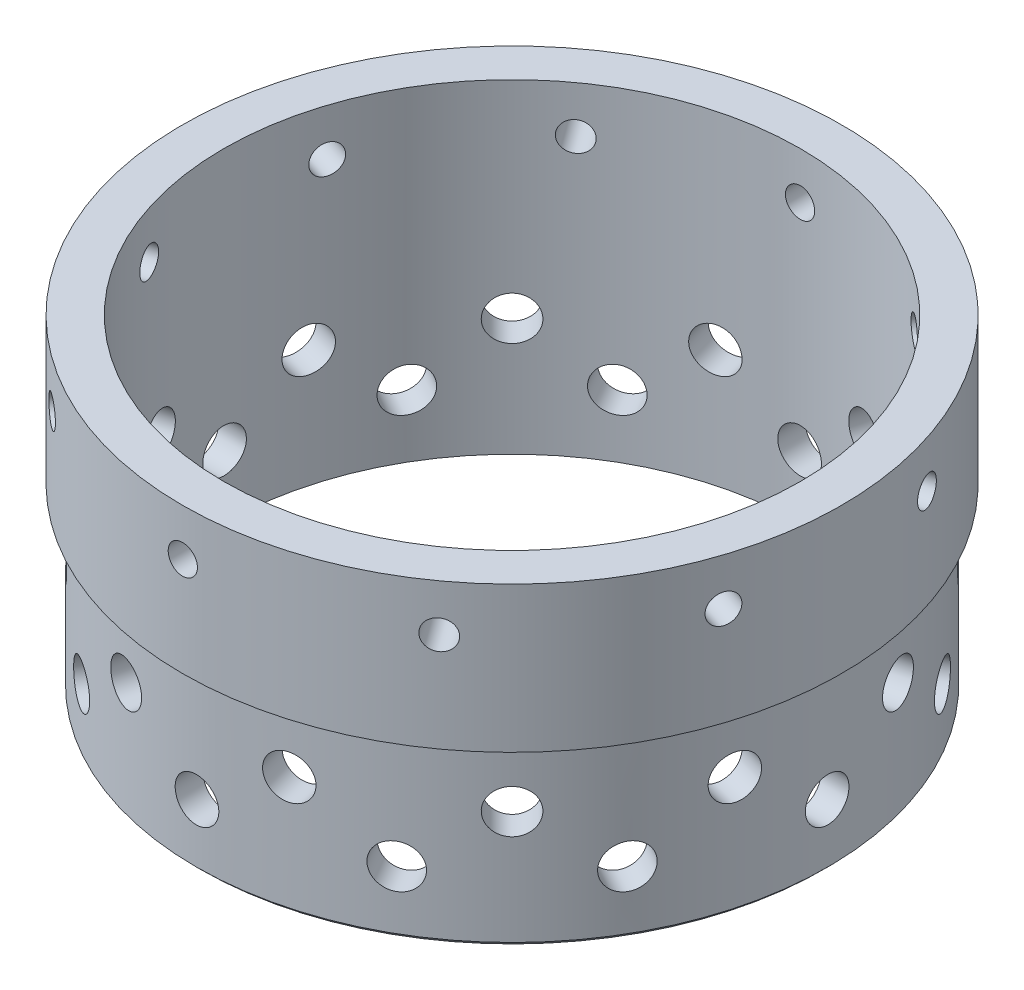
from build123d import *

# Parameters (mm, degrees)
SKETCH1_R           = 76.1238
SKETCH1_R_2         = 66.5988
BOSS_EXTRUDE1_DEPTH = 12.7
BOSS_EXTRUDE2_START = -41.275
SKETCH1_3_R         = 72.9488
SKETCH1_3_R_2       = 66.5988
BOSS_EXTRUDE2_DEPTH = 41.275
SKETCH1_4_R         = 76.1238
SKETCH1_4_R_2       = 66.5988
BOSS_EXTRUDE3_DEPTH = 33.655
CHAMFER1_SIZE       = 1
SKETCH2_R           = 5.0419
CUT_EXTRUDE1_DEPTH  = 116.296537146
SKETCH3_R           = 5.0419
CUT_EXTRUDE2_DEPTH  = 38.1
CIRPATTERN2_COUNT   = 12
SKETCH2_3_R         = 3.3782
CUT_EXTRUDE3_DEPTH  = 116.296537182
CIRPATTERN3_COUNT   = 10
FILLET1_R           = 0.4064


with BuildPart() as part:
    # Sketch1 → Boss-Extrude1 (new body)
    with BuildSketch(Plane(origin=(0, 0, 0), x_dir=(1, 0, 0), z_dir=(0, 1, 0))):
        Circle(SKETCH1_R)
        Circle(SKETCH1_R_2, mode=Mode.SUBTRACT)
    extrude(amount=BOSS_EXTRUDE1_DEPTH)

    # Sketch1<3> → Boss-Extrude2 (add)
    with BuildSketch(Plane(origin=(0, 0, 0), x_dir=(1, 0, 0), z_dir=(0, 1, 0)).offset(BOSS_EXTRUDE2_START)):
        Circle(SKETCH1_3_R)
        Circle(SKETCH1_3_R_2, mode=Mode.SUBTRACT)
    extrude(amount=BOSS_EXTRUDE2_DEPTH)

    # Sketch1<4> → Boss-Extrude3 (add)
    with BuildSketch(Plane(origin=(0, 0, 0), x_dir=(1, 0, 0), z_dir=(0, 1, 0))):
        Circle(SKETCH1_4_R)
        Circle(SKETCH1_4_R_2, mode=Mode.SUBTRACT)
    extrude(amount=BOSS_EXTRUDE3_DEPTH)

    # Chamfer1
    chamfer1_edges = [part.edges().sort_by_distance(p)[0] for p in [
        (-72.9488, -41.275, 0),
    ]]
    chamfer(chamfer1_edges, length=CHAMFER1_SIZE)

    # Sketch2 → Cut-Extrude1 (cut, through all)
    with BuildSketch(Plane.XY):
        with Locations((0, -26.797)):
            Circle(SKETCH2_R)
    cut_extrude1 = extrude(amount=-CUT_EXTRUDE1_DEPTH, mode=Mode.SUBTRACT)

    # Sketch3 → Cut-Extrude2 (cut)
    with BuildSketch(Plane(origin=(-19.702289226, 0, 73.529944415), x_dir=(0, -1, 0), z_dir=(-0.25881904510252135, 0, 0.9659258262890681))):
        with Locations((14.097, 0)):
            Circle(SKETCH3_R)
    cut_extrude2 = extrude(amount=-CUT_EXTRUDE2_DEPTH, mode=Mode.SUBTRACT)

    # CirPattern2: Cut-Extrude1, Cut-Extrude2 ×12 about axis
    cirpattern2_axis = Axis((0, 12.7, 0), (0, -1, 0))
    add([cut_extrude1.rotate(cirpattern2_axis, i * 360 / CIRPATTERN2_COUNT) for i in range(1, CIRPATTERN2_COUNT)], mode=Mode.SUBTRACT)
    add([cut_extrude2.rotate(cirpattern2_axis, i * 360 / CIRPATTERN2_COUNT) for i in range(1, CIRPATTERN2_COUNT)], mode=Mode.SUBTRACT)

    # Sketch2<3> → Cut-Extrude3 (cut, through all)
    with BuildSketch(Plane.XY):
        with Locations((0, 22.86)):
            Circle(SKETCH2_3_R)
    cut_extrude3 = extrude(amount=-CUT_EXTRUDE3_DEPTH, mode=Mode.SUBTRACT)

    # CirPattern3: Cut-Extrude3 ×10 about axis
    cirpattern3_axis = Axis((0, 12.7, 0), (0, -1, 0))
    for i in range(1, CIRPATTERN3_COUNT):
        add(cut_extrude3.rotate(cirpattern3_axis, i * 360 / CIRPATTERN3_COUNT), mode=Mode.SUBTRACT)

    # Fillet1
    fillet1_edges = [part.edges().sort_by_distance(p)[0] for p in [
        (-72.9488, 0, 0),
    ]]
    fillet(fillet1_edges, radius=FILLET1_R)


solid = part.part
